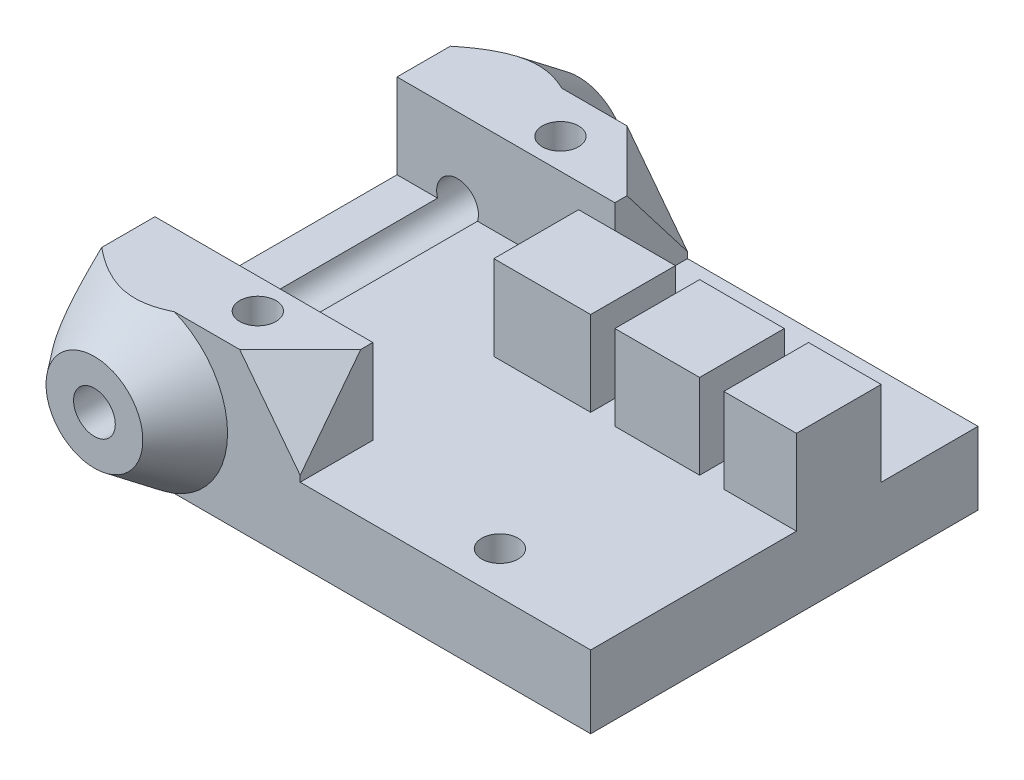
from build123d import *

# Parameters (mm, degrees)
SKETCH1_W           = 42
SKETCH1_H           = 32
BOSS_EXTRUDE1_DEPTH = 6
SKETCH4_W           = 18
SKETCH4_H           = 6
SKETCH4_W_2         = 7
SKETCH4_H_2         = 7
SKETCH4_W_3         = 6
SKETCH4_W_4         = 8
BOSS_EXTRUDE2_DEPTH = 7
SKETCH9_R           = 1.725
CUT_EXTRUDE2_DEPTH  = 61.301326685
SKETCH10_W          = 6
SKETCH10_H          = 13
BOSS_EXTRUDE5_DEPTH = 11
SKETCH5_R           = 1.5
CUT_EXTRUDE3_DEPTH  = 57.824290581
CHAMFER1_START      = 14.286772629
CHAMFER1_DEPTH      = 3.105820136
CHAMFER2_START      = -5.671483031
CHAMFER2_DEPTH      = 11.890532792


with BuildPart() as part:
    # Sketch1 → Boss-Extrude1 (new body)
    with BuildSketch(Plane(origin=(0, 0, 0), x_dir=(1, 0, 0), z_dir=(0, 1, 0))):
        with Locations((21, 16)):
            Rectangle(SKETCH1_W, SKETCH1_H)
    extrude(amount=BOSS_EXTRUDE1_DEPTH)

    # Sketch3 → Revolve2 (revolve)
    with BuildSketch(Plane(origin=(0, 6.5, 0), x_dir=(1, 0, 0), z_dir=(0, 1, 0)), mode=Mode.PRIVATE) as revolve2_sk:
        Polygon((5, 28), (-5, 28), (1, 36), (5, 36), align=None)
        Polygon((5, -4), (5, 4), (-5, 4), (1, -4), align=None)
    revolve(revolve2_sk.sketch.rotate(Axis((5, 6.5, -28), (0, 0, 1)), 177.134016017), axis=Axis((5, 6.5, -28), (0, 0, 1)))

    # Sketch4 → Boss-Extrude2 (add)
    with BuildSketch(Plane(origin=(0, 6, 0), x_dir=(1, 0, 0), z_dir=(0, 1, 0))):
        with Locations((9, 29)):
            Rectangle(SKETCH4_W, SKETCH4_H)
        with Locations((30.5, 20.5)):
            Rectangle(SKETCH4_W_2, SKETCH4_H_2)
        with Locations((39, 20.5)):
            Rectangle(SKETCH4_W_3, SKETCH4_H_2)
        with Locations((21, 20.5)):
            Rectangle(SKETCH4_W_4, SKETCH4_H_2)
        with Locations((9, 3)):
            Rectangle(SKETCH4_W, SKETCH4_H)
    extrude(amount=BOSS_EXTRUDE2_DEPTH)

    # Sketch7 → Cut-Revolve1 (revolve, cut)
    with BuildSketch(Plane(origin=(0, 6.5, 0), x_dir=(1, 0, 0), z_dir=(0, 1, 0))):
        Polygon((-5, 4), (1, -4), (-5, -4), align=None)
        Polygon((-5, 28), (1, 36), (-5, 36), align=None)
    revolve(axis=Axis((5, 6.5, -36), (0, 0, 1)), mode=Mode.SUBTRACT)

    # Sketch9 → Cut-Extrude2 (cut, through all)
    with BuildSketch(Plane.XY.offset(4)):
        with Locations((5, 6.5)):
            Circle(SKETCH9_R)
        Polygon((18, 13), (0, 13), (0, 0), (18, 0), (18, -5), (-7, -5), (-7, 18), (18, 18), align=None)
    extrude(amount=-CUT_EXTRUDE2_DEPTH, mode=Mode.SUBTRACT)

    # Sketch10 → Boss-Extrude5 (add)
    with BuildSketch(Plane(origin=(18, 0, 0), x_dir=(0, 0, -1), z_dir=(1, 0, 0))):
        with Locations((3, 6.5)):
            Rectangle(SKETCH10_W, SKETCH10_H)
        with Locations((29, 6.5)):
            Rectangle(SKETCH10_W, SKETCH10_H)
    extrude(amount=-BOSS_EXTRUDE5_DEPTH)

    # Sketch5 → Cut-Extrude3 (cut, through all)
    with BuildSketch(Plane(origin=(0, 0, 0), x_dir=(1, 0, 0), z_dir=(0, 1, 0))):
        with Locations(Location((11, 28.5, 0), (0, 0, 270))):
            Circle(SKETCH5_R)
        with Locations(Location((31, 28.5, 0), (0, 0, 90))):
            Circle(SKETCH5_R)
        with Locations(Location((31, 3.5, 0), (0, 0, 90))):
            Circle(SKETCH5_R)
        with Locations(Location((11, 3.5, 0), (0, 0, 270))):
            Circle(SKETCH5_R)
    extrude(amount=CUT_EXTRUDE3_DEPTH, mode=Mode.SUBTRACT)

    # Chamfer1: read off the stored shape, not the designer's step
    # Chamfer1 outline → Chamfer1 (cut)
    with BuildSketch(Plane(origin=(0, 0, 0), x_dir=(0.7836805797909963, -0.3787303917205566, -0.49234950923672277), z_dir=(0.6211640273377459, 0.4778184825674969, 0.6211640273377449)).offset(CHAMFER1_START)):
        Polygon((11.64450289, 5.152055929), (11.64450289, 13.352665663), (5.264352445, 10.304111858), align=None)
    extrude(amount=CHAMFER1_DEPTH, mode=Mode.SUBTRACT)

    # Chamfer2: read off the stored shape, not the designer's step
    # Chamfer2 outline → Chamfer2 (cut)
    with BuildSketch(Plane(origin=(0, 0, 0), x_dir=(0.7926239891045996, 0.6097107608496931, 0), z_dir=(0.6097107608496931, -0.7926239891045995, 0)).offset(CHAMFER2_START)):
        Polygon((22.193471695, -27), (18.230351749, -32), (24, -32), (24, -25), (23.778719673, -25), align=None)
    extrude(amount=CHAMFER2_DEPTH, mode=Mode.SUBTRACT)


solid = part.part
